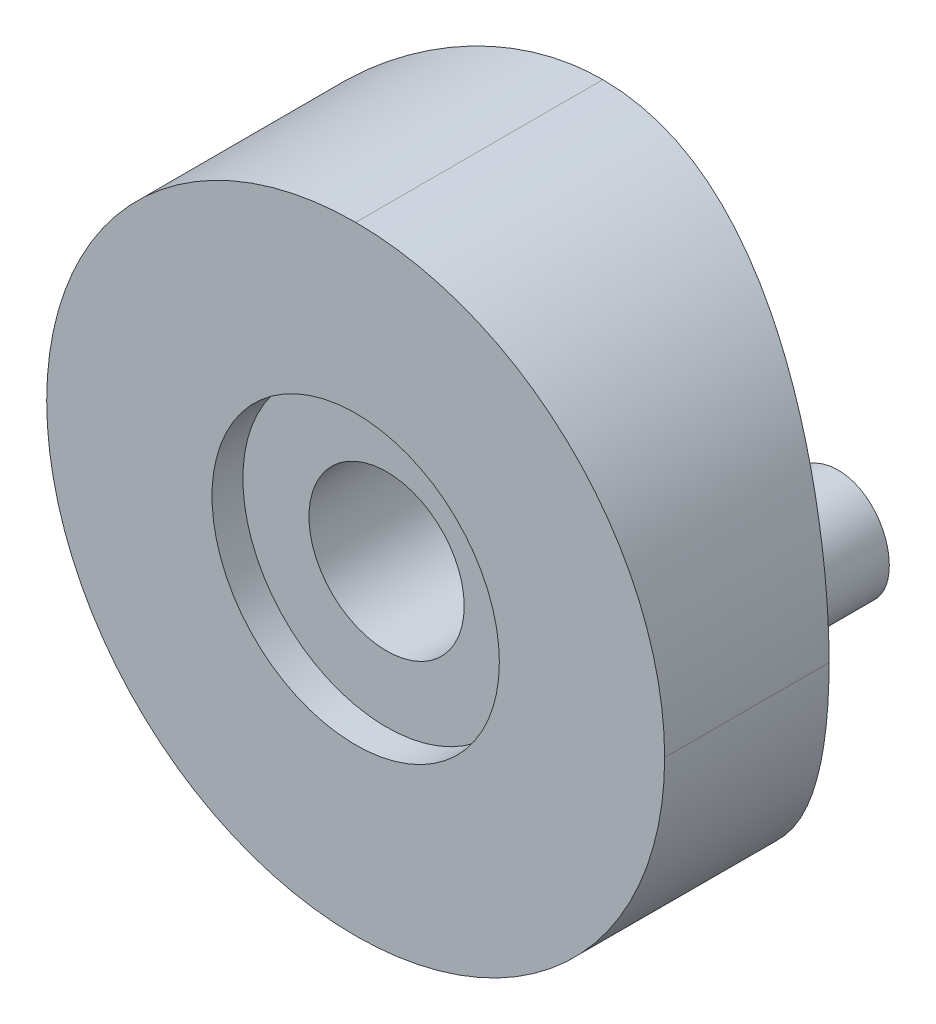
from build123d import *

# Parameters (mm, degrees)
BOSS_EXTRUDE2_DEPTH      = 20
FILLET1_START            = -1
FILLET1_DEPTH            = 9
CUT_EXTRUDE2_REACH       = 31.394
CUT_EXTRUDE2_END_RADIUS  = 20
SKETCH4_R                = 2.5125
BOSS_EXTRUDE3_REACH      = 31.394
BOSS_EXTRUDE3_END_RADIUS = 16.3
SKETCH6_R                = 1.75
SKETCH7_R                = 4.65
CUT_EXTRUDE4_DEPTH       = 1


with BuildPart() as part:
    # Sketch3 → Boss-Extrude2 (new body)
    with BuildSketch(Plane(origin=(0, 0, 0), x_dir=(0, 0, -1), z_dir=(1, 0, 0))):
        with BuildLine():
            Line((0, 20), (-8, 20))
            Line((-8, 20), (-8, 0))
            Line((-8, 0), (0, 0))
            ThreePointArc((0, 0), (-2.679491924, 10), (0, 20))
        make_face()
    extrude(amount=BOSS_EXTRUDE2_DEPTH)

    # Fillet1: read off the stored shape, not the designer's step
    # Fillet1 outline → Fillet1 (cut)
    with BuildSketch(Plane.XY.offset(FILLET1_START)):
        with BuildLine():
            Line((0, 20), (0, 10))
            ThreePointArc((0, 10), (2.928932188, 17.071067812), (10, 20))
            Line((10, 20), (0, 20))
        make_face()
        with BuildLine():
            ThreePointArc((10, 0), (2.928932188, 2.928932188), (0, 10))
            Line((0, 10), (0, 0))
            Line((0, 0), (10, 0))
        make_face()
        with BuildLine():
            Line((20, 20), (10, 20))
            ThreePointArc((10, 20), (17.071067812, 17.071067812), (20, 10))
            Line((20, 10), (20, 20))
        make_face()
        with BuildLine():
            ThreePointArc((20, 10), (17.071067812, 2.928932188), (10, 0))
            Line((10, 0), (20, 0))
            Line((20, 0), (20, 10))
        make_face()
    extrude(amount=FILLET1_DEPTH, mode=Mode.SUBTRACT)

    # Cut-Extrude2: up to this cylinder (the profile starts outside it)
    cut_extrude2_end = Plane(origin=(10, 10, -17.320508076), z_dir=(-1, 0, 0)) * Cylinder(CUT_EXTRUDE2_END_RADIUS, 103.788, mode=Mode.PRIVATE)
    # Sketch4 → Cut-Extrude2 (cut, up to the surface)
    with BuildSketch(Plane.XY.offset(8), mode=Mode.PRIVATE) as cut_extrude2_sk1:
        with Locations((10, 10)):
            Circle(SKETCH4_R)
    cut_extrude2_tool1 = extrude(cut_extrude2_sk1.sketch, amount=-CUT_EXTRUDE2_REACH, mode=Mode.PRIVATE) - cut_extrude2_end
    add(cut_extrude2_tool1.solids().sort_by_distance((10, 10, 8))[0], mode=Mode.SUBTRACT)

    # Boss-Extrude3: up to this cylinder (the profile starts outside it)
    boss_extrude3_end = Plane(origin=(10, 10, -17.320508076), z_dir=(-1, 0, 0)) * Cylinder(BOSS_EXTRUDE3_END_RADIUS, 109.388, mode=Mode.PRIVATE)
    # Sketch6 → Boss-Extrude3 (add, up to the surface)
    with BuildSketch(Plane.XY.offset(8), mode=Mode.PRIVATE) as boss_extrude3_sk1:
        with Locations((3.5, 10)):
            Circle(SKETCH6_R)
    boss_extrude3_tool1 = extrude(boss_extrude3_sk1.sketch, amount=-BOSS_EXTRUDE3_REACH, mode=Mode.PRIVATE) - boss_extrude3_end
    add(boss_extrude3_tool1.solids().sort_by_distance((3.5, 10, 8))[0])
    # Sketch6 → Boss-Extrude3 (add, up to the surface)
    with BuildSketch(Plane.XY.offset(8), mode=Mode.PRIVATE) as boss_extrude3_sk2:
        with Locations((16.5, 10)):
            Circle(SKETCH6_R)
    boss_extrude3_tool2 = extrude(boss_extrude3_sk2.sketch, amount=-BOSS_EXTRUDE3_REACH, mode=Mode.PRIVATE) - boss_extrude3_end
    add(boss_extrude3_tool2.solids().sort_by_distance((16.5, 10, 8))[0])

    # Sketch7 → Cut-Extrude4 (cut)
    with BuildSketch(Plane.XY.offset(8)):
        with Locations((10, 10)):
            Circle(SKETCH7_R)
    extrude(amount=-CUT_EXTRUDE4_DEPTH, mode=Mode.SUBTRACT)


solid = part.part
